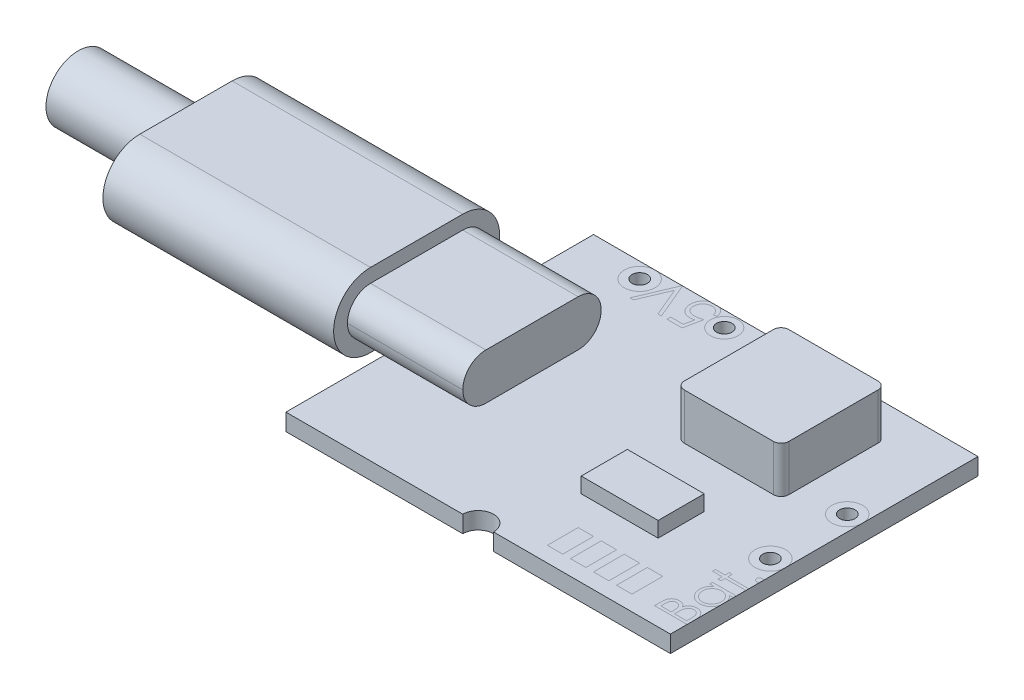
from build123d import *

# Parameters (mm, degrees)
CROQUIS1_R              = 0.5
SALIENTE_EXTRUIR1_DEPTH = 1.1
CROQUIS2_W              = 7.5
CROQUIS2_H              = 9
SALIENTE_EXTRUIR2_DEPTH = 3
REDONDEO1_R             = 1.5
CROQUIS3_W              = 6.8
CROQUIS3_H              = 6.8
SALIENTE_EXTRUIR3_DEPTH = 3
REDONDEO2_R             = 0.5
CROQUIS4_W              = 5
CROQUIS4_H              = 3
SALIENTE_EXTRUIR4_DEPTH = 1
SALIENTE_EXTRUIR5_DEPTH = 15
CROQUIS7_R              = 2.1
SALIENTE_EXTRUIR6_DEPTH = 7


with BuildPart() as part:
    # Croquis1 → Saliente-Extruir1 (new body)
    with BuildSketch(Plane(origin=(0, 0, 0), x_dir=(1, 0, 0), z_dir=(0, 1, 0))):
        with BuildLine():
            Line((-12.5, 10), (-1, 10))
            ThreePointArc((-1, 10), (0, 9), (1, 10))
            Line((1, 10), (12.5, 10))
            Line((12.5, 10), (12.5, -10))
            Line((12.5, -10), (1, -10))
            ThreePointArc((1, -10), (0, -9), (-1, -10))
            Line((-1, -10), (-12.5, -10))
            Line((-12.5, -10), (-12.5, 10))
        make_face()
        with Locations(Location((11.5, 2.5, 0), (0, 0, 270))):
            Circle(CROQUIS1_R, mode=Mode.SUBTRACT)
        with Locations(Location((11.5, -2.5, 0), (0, 0, 90))):
            Circle(CROQUIS1_R, mode=Mode.SUBTRACT)
        with Locations(Location((-8.5, 9, 0), (0, 0, 270))):
            Circle(CROQUIS1_R, mode=Mode.SUBTRACT)
        with Locations(Location((-3, 9, 0), (0, 0, 270))):
            Circle(CROQUIS1_R, mode=Mode.SUBTRACT)
    extrude(amount=SALIENTE_EXTRUIR1_DEPTH)


with BuildPart() as body_2:
    # Croquis2 → Saliente-Extruir2 (new body)
    with BuildSketch(Plane(origin=(0, 1.1, 0), x_dir=(1, 0, 0), z_dir=(0, 1, 0))):
        with Locations((-10.25, 0)):
            Rectangle(CROQUIS2_W, CROQUIS2_H)
    extrude(amount=SALIENTE_EXTRUIR2_DEPTH)

    # Redondeo1
    redondeo1_edges = [body_2.edges().sort_by_distance(p)[0] for p in [
        (-10.25, 1.1, -4.5),
        (-10.25, 4.1, -4.5),
        (-10.25, 1.1, 4.5),
        (-10.25, 4.1, 4.5),
    ]]
    fillet(redondeo1_edges, radius=REDONDEO1_R - 0.0001)  # a hair under: the kernel refuses the full size

    # Combinar1: union part
    add(part.part)

    # Croquis3 → Saliente-Extruir3 (add)
    with BuildSketch(Plane(origin=(0, 1.1, 0), x_dir=(1, 0, 0), z_dir=(0, 1, 0))):
        with Locations((5.1, 4.6)):
            Rectangle(CROQUIS3_W, CROQUIS3_H)
    extrude(amount=SALIENTE_EXTRUIR3_DEPTH)

    # Redondeo2
    redondeo2_edges = [body_2.edges().sort_by_distance(p)[0] for p in [
        (8.5, 2.6, -1.2),
        (8.5, 2.6, -8),
        (1.7, 2.6, -8),
        (1.7, 2.6, -1.2),
    ]]
    fillet(redondeo2_edges, radius=REDONDEO2_R)

    # Croquis4 → Saliente-Extruir4 (add)
    with BuildSketch(Plane(origin=(0, 1.1, 0), x_dir=(1, 0, 0), z_dir=(0, 1, 0))):
        with Locations((4.2, -3.5)):
            Rectangle(CROQUIS4_W, CROQUIS4_H)
    extrude(amount=SALIENTE_EXTRUIR4_DEPTH)

    # Croquis6 → Saliente-Extruir5 (add)
    with BuildSketch(Plane.ZY.offset(14)):
        with BuildLine():
            Line((-3, 0.2), (3, 0.2))
            ThreePointArc((3, 0.2), (4.697056275, 0.902943725), (5.4, 2.6))
            ThreePointArc((5.4, 2.6), (4.697056275, 4.297056275), (3, 5))
            Line((3, 5), (-3, 5))
            ThreePointArc((-3, 5), (-4.697056275, 4.297056275), (-5.4, 2.6))
            ThreePointArc((-5.4, 2.6), (-4.697056275, 0.902943725), (-3, 0.2))
        make_face()
    extrude(amount=SALIENTE_EXTRUIR5_DEPTH)

    # Croquis7 → Saliente-Extruir6 (add)
    with BuildSketch(Plane.ZY.offset(29)):
        with Locations((0, 2.6)):
            Circle(CROQUIS7_R)
    extrude(amount=SALIENTE_EXTRUIR6_DEPTH)


solid = body_2.part
